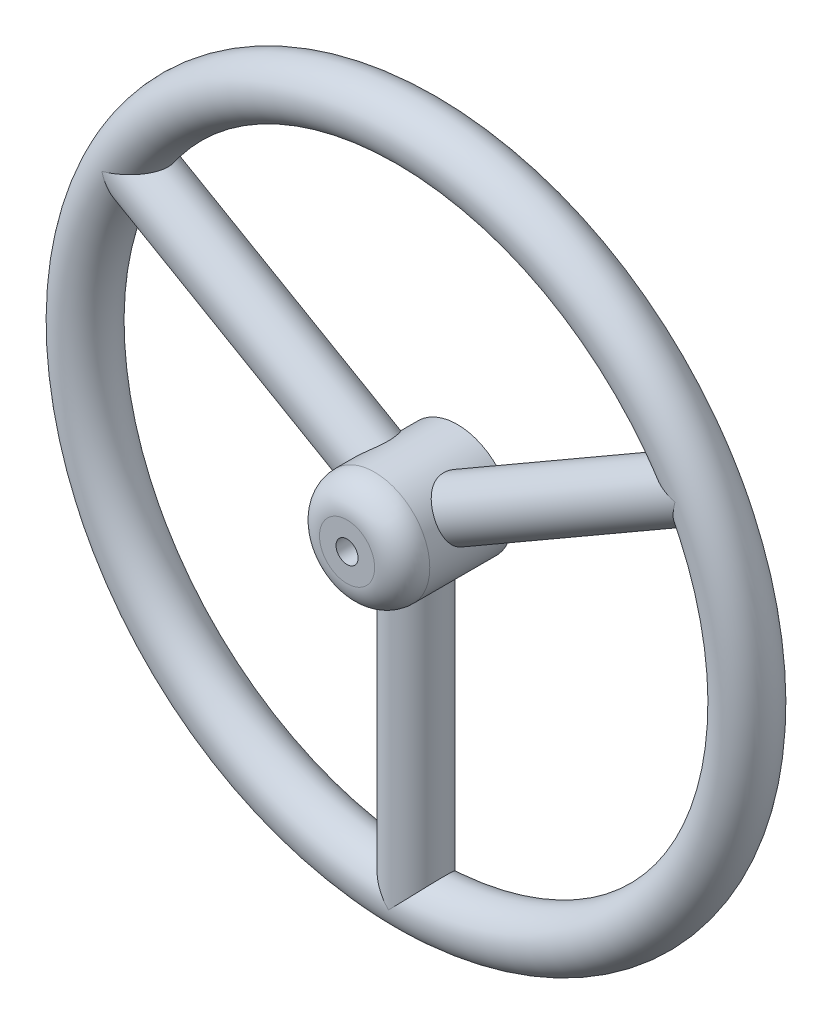
from build123d import *
from build123d.topology import SkipClean

# Parameters (mm, degrees)
SKETCH6_R                      = 10
SKETCH7_R                      = 20
SKETCH7_R_2                    = 8
BOSS_EXTRUDE1_DEPTH            = 15
BOSS_EXTRUDE3_REACH            = 236.84
BOSS_EXTRUDE3_END_MAJOR_RADIUS = 120
BOSS_EXTRUDE3_END_MINOR_RADIUS = 10
SKETCH8_R                      = 10
SKETCH8_R_2                    = 6
CUT_EXTRUDE1_DEPTH             = 187.279360242
CIRPATTERN2_COUNT              = 3
BOSS_EXTRUDE4_REACH            = 236.84
BOSS_EXTRUDE4_END_RADIUS       = 20
SKETCH11_R                     = 10
SKETCH11_R_2                   = 6
BOSS_EXTRUDE5_REACH            = 249.661
SKETCH12_R                     = 10
SKETCH12_R_2                   = 6
BOSS_EXTRUDE6_REACH            = 249.661
SKETCH13_R                     = 10
SKETCH13_R_2                   = 6
BOSS_EXTRUDE7_START            = 10
SKETCH14_R                     = 20
SKETCH14_R_2                   = 4
BOSS_EXTRUDE7_DEPTH            = 10
FILLET1_R                      = 10


with BuildPart() as part:
    # Sketch6 → Revolve1 (revolve)
    with BuildSketch(Plane(origin=(0, 0, 0), x_dir=(1, 0, 0), z_dir=(0, 1, 0))):
        with Locations((120, 0)):
            Circle(SKETCH6_R)
    revolve(axis=Axis((0, 0, 0), (0, 0, -1)))

    # Boss-Extrude3: up to this torus (the profile starts outside it)
    boss_extrude3_end = Plane(origin=(0, 0, 0), z_dir=(0, 0, 1)) * Torus(BOSS_EXTRUDE3_END_MAJOR_RADIUS, BOSS_EXTRUDE3_END_MINOR_RADIUS, mode=Mode.PRIVATE)
    # Sketch8 → Boss-Extrude3 (add, up to the surface)
    with BuildSketch(Plane(origin=(0, -65, 0), x_dir=(1, 0, 0), z_dir=(0, 1, 0)), mode=Mode.PRIVATE) as boss_extrude3_sk1:
        with Locations(Location((0, 0, 0), (0, 0, 270))):
            Circle(SKETCH8_R)
        with Locations(Location((0, 0, 0), (0, 0, 270))):
            Circle(SKETCH8_R_2, mode=Mode.SUBTRACT)
    boss_extrude3_tool1 = extrude(boss_extrude3_sk1.sketch, amount=-BOSS_EXTRUDE3_REACH, mode=Mode.PRIVATE) - boss_extrude3_end
    boss_extrude3 = boss_extrude3_tool1.solids().sort_by_distance((0, -65, -9.717157))[0]
    add(boss_extrude3)

    # CirPattern2: Boss-Extrude3 ×3 about axis
    cirpattern2_axis = Axis((0, 0, 0), (0, 0, 1))
    for i in range(1, CIRPATTERN2_COUNT):
        add(boss_extrude3.rotate(cirpattern2_axis, i * 360 / CIRPATTERN2_COUNT))



with BuildPart() as body_2:
    # Sketch7 → Boss-Extrude1 (new, symmetric)
    with BuildSketch(Plane.XY):
        Circle(SKETCH7_R)
        Circle(SKETCH7_R_2, mode=Mode.SUBTRACT)
    extrude(amount=BOSS_EXTRUDE1_DEPTH, both=True)

    # Sketch10 → Cut-Extrude1 (cut, through all)
    with BuildSketch(Plane.XY.offset(15)):
        with BuildLine():
            Line((-9.268318348, 1.39), (-7.878318348, 1.39))
            ThreePointArc((-7.878318348, 1.39), (-8, 0), (-7.878318348, -1.39))
            Line((-7.878318348, -1.39), (-9.268318348, -1.39))
            Line((-9.268318348, -1.39), (-9.268318348, 1.39))
        make_face()
    extrude(amount=-CUT_EXTRUDE1_DEPTH, mode=Mode.SUBTRACT)


with BuildPart() as part_1:
    with SkipClean():  # the faces are left unmerged after this step: merging them gives an invalid solid
        add(part.part)

        add(body_2.part)  # Boss-Extrude4 merges body 2
        # Boss-Extrude4: up to this cylinder (the profile starts outside it)
        boss_extrude4_end = Plane(origin=(0, 0, 9.717157), z_dir=(0, 0, -1)) * Cylinder(BOSS_EXTRUDE4_END_RADIUS, 514.68, mode=Mode.PRIVATE)
        # Sketch11 → Boss-Extrude4 (add, up to the surface)
        with BuildSketch(Plane(origin=(0, -65, 0), x_dir=(1, 0, 0), z_dir=(0, 1, 0)), mode=Mode.PRIVATE) as boss_extrude4_sk1:
            with Locations(Location((0, 0, 0), (0, 0, 90))):
                Circle(SKETCH11_R)
            with Locations(Location((0, 0, 0), (0, 0, 90))):
                Circle(SKETCH11_R_2, mode=Mode.SUBTRACT)
        boss_extrude4_tool1 = extrude(boss_extrude4_sk1.sketch, amount=BOSS_EXTRUDE4_REACH, mode=Mode.PRIVATE) - boss_extrude4_end
        add(boss_extrude4_tool1.solids().sort_by_distance((0, -65, 9.717157))[0])

    # Sketch12 → Boss-Extrude5 (add, up to next)
    with BuildSketch(Plane(origin=(-56.291651246, 32.5, 0), x_dir=(0, 0, -1), z_dir=(0.8660254037844365, -0.500000000000004, 0)), mode=Mode.PRIVATE) as boss_extrude5_sk1:
        with Locations(Location((0, 0, 0), (0, 0, 180))):
            Circle(SKETCH12_R)
        with Locations(Location((0, 0, 0), (0, 0, 290.164094265))):
            Circle(SKETCH12_R_2, mode=Mode.SUBTRACT)
    boss_extrude5_tool1 = extrude(boss_extrude5_sk1.sketch, amount=BOSS_EXTRUDE5_REACH, mode=Mode.PRIVATE) - part_1.part
    add(boss_extrude5_tool1.solids().sort_by_distance((-56.291651, 32.5, -9.717157))[0])

    # Sketch13 → Boss-Extrude6 (add, up to next)
    with BuildSketch(Plane(origin=(56.291651246, 32.5, 0), x_dir=(0, 0, 1), z_dir=(-0.8660254037844434, -0.49999999999999195, 0)), mode=Mode.PRIVATE) as boss_extrude6_sk1:
        with Locations(Location((0, 0, 0), (0, 0, 180))):
            Circle(SKETCH13_R)
        with Locations(Location((0, 0, 0), (0, 0, 105.114089156))):
            Circle(SKETCH13_R_2, mode=Mode.SUBTRACT)
    boss_extrude6_tool1 = extrude(boss_extrude6_sk1.sketch, amount=BOSS_EXTRUDE6_REACH, mode=Mode.PRIVATE) - part_1.part
    add(boss_extrude6_tool1.solids().sort_by_distance((56.291651, 32.5, 9.717157))[0])

    # Sketch14 → Boss-Extrude7 (add)
    with SkipClean():  # the faces are left unmerged after this step: merging them gives an invalid solid
        with BuildSketch(Plane.XY.offset(15).offset(BOSS_EXTRUDE7_START)):
            Circle(SKETCH14_R)
            Circle(SKETCH14_R_2, mode=Mode.SUBTRACT)
        extrude(amount=-BOSS_EXTRUDE7_DEPTH)

    # Fillet1
    fillet1_edges = [part_1.edges().sort_by_distance(p)[0] for p in [
        (-20, 0, 25),
    ]]
    fillet(fillet1_edges, radius=FILLET1_R - 0.0001)  # a hair under: the kernel refuses the full size


solid = part_1.part
